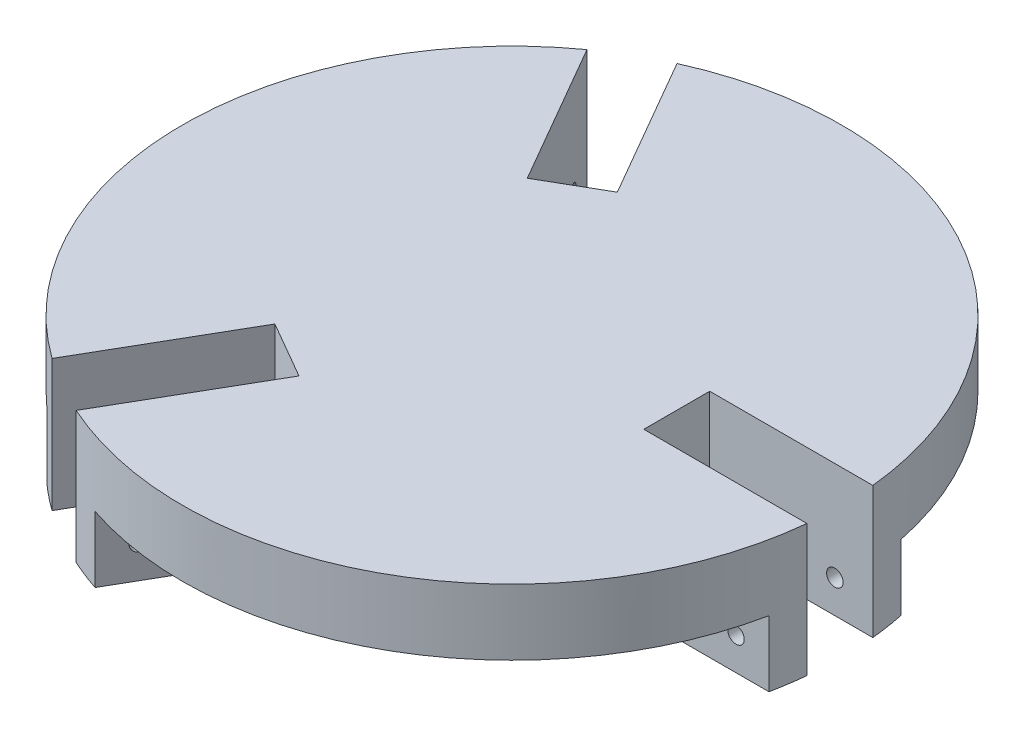
from build123d import *

# Parameters (mm, degrees)
ESQUISSE1_R                  = 50
BOSS_EXTRU_1_DEPTH           = 5
ESQUISSE2_W                  = 25
ESQUISSE2_H                  = 10
ENL_V_MAT_EXTRU_1_DEPTH      = 72.414284285
R_P_TITION_CIRCULAIRE_COUNT  = 3
BOSS_EXTRU_2_DEPTH           = 10
R_P_TITION_CIRCULAIRE1_COUNT = 3
TROU_TARAUD_M31_D            = 2.5
R_P_TITION_CIRCULAIRE2_COUNT = 3


with BuildPart() as part:
    # Esquisse1 → Boss.-Extru.1 (new, symmetric)
    with BuildSketch(Plane(origin=(0, 0, 0), x_dir=(1, 0, 0), z_dir=(0, 1, 0))):
        Circle(ESQUISSE1_R)
    extrude(amount=BOSS_EXTRU_1_DEPTH, both=True)

    # Esquisse2 → Enlèv. mat.-Extru.1 (cut, through all)
    with BuildSketch(Plane(origin=(0, 5, 0), x_dir=(1, 0, 0), z_dir=(0, 1, 0))):
        with Locations((37.5, 0)):
            Rectangle(ESQUISSE2_W, ESQUISSE2_H)
    enl_v_mat_extru_1 = extrude(amount=-ENL_V_MAT_EXTRU_1_DEPTH, mode=Mode.SUBTRACT)

    # Répétition circulaire: Enlèv. mat.-Extru.1 ×3 about axis
    r_p_tition_circulaire_axis = Axis((0, 5, 0), (0, 1, 0))
    for i in range(1, R_P_TITION_CIRCULAIRE_COUNT):
        add(enl_v_mat_extru_1.rotate(r_p_tition_circulaire_axis, i * 360 / R_P_TITION_CIRCULAIRE_COUNT), mode=Mode.SUBTRACT)

    # Esquisse3 → Boss.-Extru.2 (add)
    with BuildSketch(Plane.XZ.offset(5)):
        with BuildLine():
            Line((48.989794856, 10), (20, 10))
            Line((20, 10), (20, -10))
            Line((20, -10), (48.989794856, -10))
            ThreePointArc((48.989794856, -10), (49.432840913, -7.509609797), (49.749371855, -5))
            Line((49.749371855, -5), (25, -5))
            Line((25, -5), (25, 5))
            Line((25, 5), (49.749371855, 5))
            ThreePointArc((49.749371855, 5), (49.432840913, 7.509609797), (48.989794856, 10))
        make_face()
    boss_extru_2 = extrude(amount=BOSS_EXTRU_2_DEPTH)

    # Répétition circulaire1: Boss.-Extru.2 ×3 about axis
    r_p_tition_circulaire1_axis = Axis((0, -5, 0), (0, 1, 0))
    for i in range(1, R_P_TITION_CIRCULAIRE1_COUNT):
        add(boss_extru_2.rotate(r_p_tition_circulaire1_axis, i * 360 / R_P_TITION_CIRCULAIRE1_COUNT))

    # Trou taraudé M31 (through all)
    with Locations(Plane(origin=(0, 0, -10), x_dir=(-1, 0, 0), z_dir=(0, 0, -1))):
        with Locations((-43.989794856, -10), (-28.989794856, -10)):
            trou_taraud_m31 = Hole(TROU_TARAUD_M31_D / 2)

    # Répétition circulaire2: Trou taraudé M31 ×3 about axis
    r_p_tition_circulaire2_axis = Axis((0, 5, 0), (0, 1, 0))
    for i in range(1, R_P_TITION_CIRCULAIRE2_COUNT):
        add(trou_taraud_m31.rotate(r_p_tition_circulaire2_axis, i * 360 / R_P_TITION_CIRCULAIRE2_COUNT), mode=Mode.SUBTRACT)


solid = part.part
